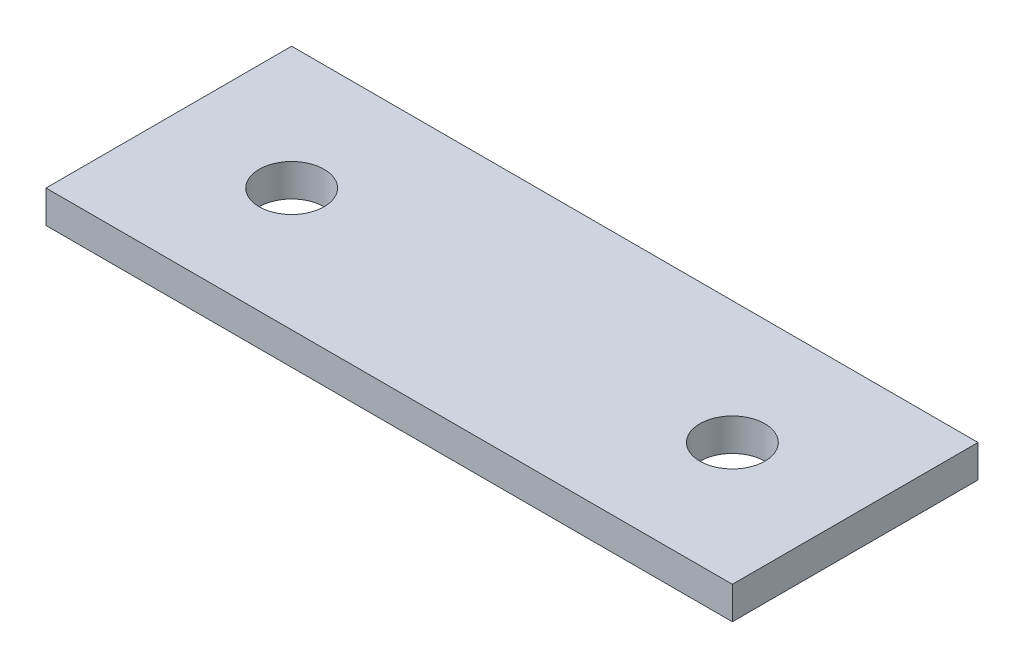
from build123d import *

# Parameters (mm, degrees)
SKETCH1_W           = 33.53
SKETCH1_H           = 12
SKETCH1_R           = 1.5875
BOSS_EXTRUDE1_DEPTH = 0.79375


with BuildPart() as part:
    # Sketch1 → Boss-Extrude1 (new, symmetric)
    with BuildSketch(Plane(origin=(0, 0, 0), x_dir=(1, 0, 0), z_dir=(0, 1, 0))):
        Rectangle(SKETCH1_W, SKETCH1_H)
        with Locations((-10.765, 0)):
            Circle(SKETCH1_R, mode=Mode.SUBTRACT)
        with Locations((10.765, 0)):
            Circle(SKETCH1_R, mode=Mode.SUBTRACT)
    extrude(amount=BOSS_EXTRUDE1_DEPTH, both=True)


solid = part.part
